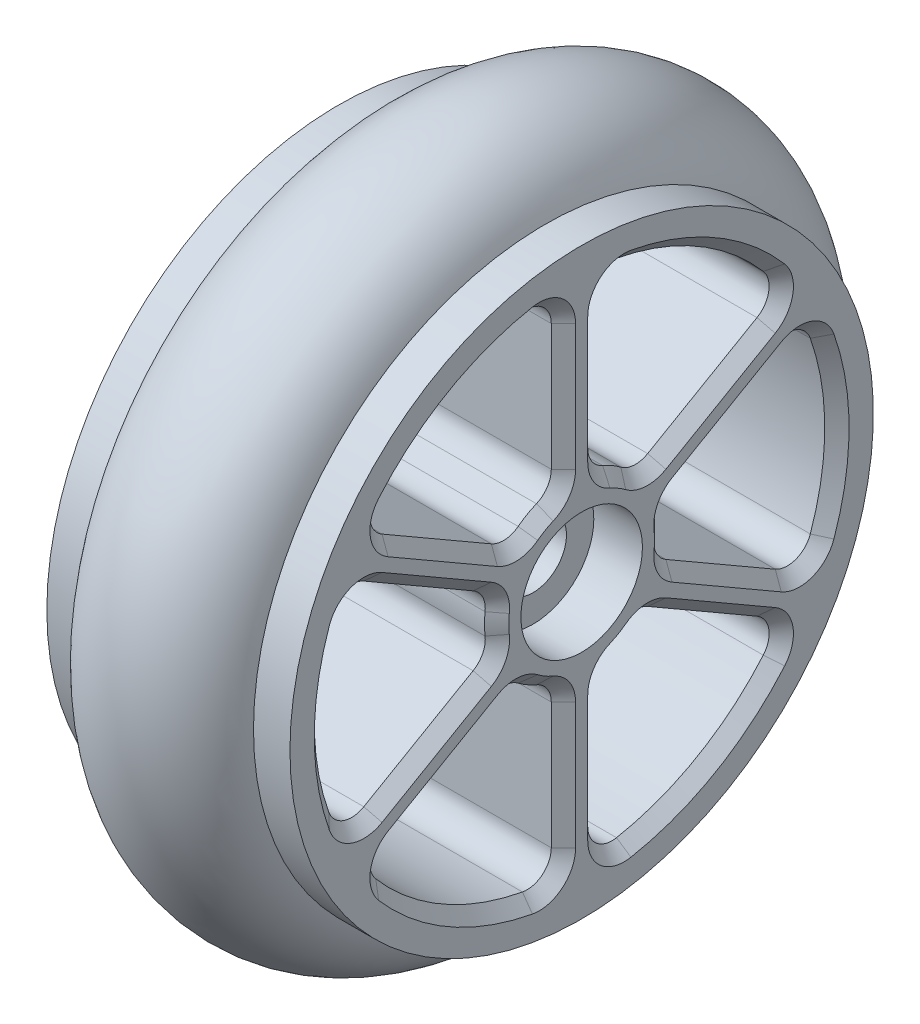
from build123d import *

# Parameters (mm, degrees)
CUT_EXTRUDE1_REACH = 47.629
SKETCH2_R          = 2.75
SKETCH3_R          = 5
CUT_EXTRUDE2_DEPTH = 4
CUT_EXTRUDE3_START = -4
SKETCH4_R          = 5
CUT_EXTRUDE3_DEPTH = 4
CUT_EXTRUDE4_REACH = 47.629
FILLET2_R          = 2
CHAMFER1_SIZE      = 1
CUT_EXTRUDE6_REACH = 55.638
SKETCH9_R          = 1.5


with BuildPart() as part:
    # Sketch1 → Revolve1 (revolve)
    with BuildSketch(Plane.XY):
        with BuildLine():
            Line((-10, 24), (-10, 0))
            Line((-10, 0), (10, 0))
            Line((10, 0), (10, 24))
            Line((10, 24), (7, 24))
            ThreePointArc((7, 24), (0, 29), (-7, 24))
            Line((-7, 24), (-10, 24))
        make_face()
    revolve(axis=Axis((-29.685693942, 0, 0), (1, 0, 0)))

    # Sketch2 → Cut-Extrude1 (cut, up to next)
    with BuildSketch(Plane(origin=(10, 0, 0), x_dir=(0, 0, -1), z_dir=(1, 0, 0)), mode=Mode.PRIVATE) as cut_extrude1_sk1:
        Circle(SKETCH2_R)
    cut_extrude1_tool1 = extrude(cut_extrude1_sk1.sketch, amount=-CUT_EXTRUDE1_REACH, mode=Mode.PRIVATE) & part.part
    add(cut_extrude1_tool1.solids().sort_by_distance((10, 0, 0))[0], mode=Mode.SUBTRACT)

    # Sketch3 → Cut-Extrude2 (cut)
    with BuildSketch(Plane.ZY.offset(10)):
        Circle(SKETCH3_R)
    extrude(amount=-CUT_EXTRUDE2_DEPTH, mode=Mode.SUBTRACT)

    # Sketch4 → Cut-Extrude3 (cut)
    with BuildSketch(Plane(origin=(10, 0, 0), x_dir=(0, 0, -1), z_dir=(1, 0, 0)).offset(CUT_EXTRUDE3_START)):
        Circle(SKETCH4_R)
    extrude(amount=CUT_EXTRUDE3_DEPTH, mode=Mode.SUBTRACT)

    # Sketch5 → Cut-Extrude4 (cut, up to next)
    with BuildSketch(Plane(origin=(10, 0, 0), x_dir=(0, 0, -1), z_dir=(1, 0, 0)), mode=Mode.PRIVATE) as cut_extrude4_sk1:
        with BuildLine():
            Line((1.5, -6.837397166), (1.5, -20.946360066))
            ThreePointArc((1.5, -20.946360066), (10.5, -18.186533479), (17.390079934, -11.772218139))
            Line((17.390079934, -11.772218139), (5.171359641, -4.717736688))
            ThreePointArc((5.171359641, -4.717736688), (3.5, -6.062177826), (1.5, -6.837397166))
        make_face()
    cut_extrude4_tool1 = extrude(cut_extrude4_sk1.sketch, amount=-CUT_EXTRUDE4_REACH, mode=Mode.PRIVATE) & part.part
    # Sketch5 → Cut-Extrude4 (cut, up to next)
    with BuildSketch(Plane(origin=(10, 0, 0), x_dir=(0, 0, -1), z_dir=(1, 0, 0)), mode=Mode.PRIVATE) as cut_extrude4_sk2:
        with BuildLine():
            Line((-1.5, -20.946360066), (-1.5, -6.837397166))
            ThreePointArc((-1.5, -6.837397166), (-3.5, -6.062177826), (-5.171359641, -4.717736688))
            Line((-5.171359641, -4.717736688), (-17.390079934, -11.772218139))
            ThreePointArc((-17.390079934, -11.772218139), (-10.5, -18.186533479), (-1.5, -20.946360066))
        make_face()
    cut_extrude4_tool2 = extrude(cut_extrude4_sk2.sketch, amount=-CUT_EXTRUDE4_REACH, mode=Mode.PRIVATE) & part.part
    # Sketch5 → Cut-Extrude4 (cut, up to next)
    with BuildSketch(Plane(origin=(10, 0, 0), x_dir=(0, 0, -1), z_dir=(1, 0, 0)), mode=Mode.PRIVATE) as cut_extrude4_sk3:
        with BuildLine():
            Line((6.671359641, -2.119660477), (18.890079934, -9.174141927))
            ThreePointArc((18.890079934, -9.174141927), (21, 0), (18.890079934, 9.174141927))
            Line((18.890079934, 9.174141927), (6.671359641, 2.119660477))
            ThreePointArc((6.671359641, 2.119660477), (7, 0), (6.671359641, -2.119660477))
        make_face()
    cut_extrude4_tool3 = extrude(cut_extrude4_sk3.sketch, amount=-CUT_EXTRUDE4_REACH, mode=Mode.PRIVATE) & part.part
    # Sketch5 → Cut-Extrude4 (cut, up to next)
    with BuildSketch(Plane(origin=(10, 0, 0), x_dir=(0, 0, -1), z_dir=(1, 0, 0)), mode=Mode.PRIVATE) as cut_extrude4_sk4:
        with BuildLine():
            Line((-18.890079934, -9.174141927), (-6.671359641, -2.119660477))
            ThreePointArc((-6.671359641, -2.119660477), (-7, 0), (-6.671359641, 2.119660477))
            Line((-6.671359641, 2.119660477), (-18.890079934, 9.174141927))
            ThreePointArc((-18.890079934, 9.174141927), (-21, 0), (-18.890079934, -9.174141927))
        make_face()
    cut_extrude4_tool4 = extrude(cut_extrude4_sk4.sketch, amount=-CUT_EXTRUDE4_REACH, mode=Mode.PRIVATE) & part.part
    # Sketch5 → Cut-Extrude4 (cut, up to next)
    with BuildSketch(Plane(origin=(10, 0, 0), x_dir=(0, 0, -1), z_dir=(1, 0, 0)), mode=Mode.PRIVATE) as cut_extrude4_sk5:
        with BuildLine():
            ThreePointArc((-5.171359641, 4.717736688), (-3.5, 6.062177826), (-1.5, 6.837397166))
            Line((-1.5, 6.837397166), (-1.5, 20.946360066))
            ThreePointArc((-1.5, 20.946360066), (-10.5, 18.186533479), (-17.390079934, 11.772218139))
            Line((-17.390079934, 11.772218139), (-5.171359641, 4.717736688))
        make_face()
    cut_extrude4_tool5 = extrude(cut_extrude4_sk5.sketch, amount=-CUT_EXTRUDE4_REACH, mode=Mode.PRIVATE) & part.part
    # Sketch5 → Cut-Extrude4 (cut, up to next)
    with BuildSketch(Plane(origin=(10, 0, 0), x_dir=(0, 0, -1), z_dir=(1, 0, 0)), mode=Mode.PRIVATE) as cut_extrude4_sk6:
        with BuildLine():
            Line((5.171359641, 4.717736688), (17.390079934, 11.772218139))
            ThreePointArc((17.390079934, 11.772218139), (10.5, 18.186533479), (1.5, 20.946360066))
            Line((1.5, 20.946360066), (1.5, 6.837397166))
            ThreePointArc((1.5, 6.837397166), (3.5, 6.062177826), (5.171359641, 4.717736688))
        make_face()
    cut_extrude4_tool6 = extrude(cut_extrude4_sk6.sketch, amount=-CUT_EXTRUDE4_REACH, mode=Mode.PRIVATE) & part.part
    add(cut_extrude4_tool1.solids().sort_by_distance((10, -12.993011, -7.501518))[0], mode=Mode.SUBTRACT)
    add(cut_extrude4_tool2.solids().sort_by_distance((10, -12.993011, 7.501518))[0], mode=Mode.SUBTRACT)
    add(cut_extrude4_tool3.solids().sort_by_distance((10, 0, -15.003037))[0], mode=Mode.SUBTRACT)
    add(cut_extrude4_tool4.solids().sort_by_distance((10, 0, 15.003037))[0], mode=Mode.SUBTRACT)
    add(cut_extrude4_tool5.solids().sort_by_distance((10, 12.993011, 7.501518))[0], mode=Mode.SUBTRACT)
    add(cut_extrude4_tool6.solids().sort_by_distance((10, 12.993011, -7.501518))[0], mode=Mode.SUBTRACT)

    # Fillet2
    fillet2_edges = [part.edges().sort_by_distance(p)[0] for p in [
        (0, 11.772218139, -17.390079934),
        (0, 4.717736688, -5.171359641),
        (0, 6.837397166, -1.5),
        (0, 20.946360066, -1.5),
        (0, 20.946360066, 1.5),
        (0, 11.772218139, 17.390079934),
        (0, 4.717736688, 5.171359641),
        (0, 6.837397166, 1.5),
        (0, 9.174141927, 18.890079934),
        (0, -9.174141927, 18.890079934),
        (0, -2.119660477, 6.671359641),
        (0, 2.119660477, 6.671359641),
        (0, -6.837397166, 1.5),
        (0, -4.717736688, 5.171359641),
        (0, -11.772218139, 17.390079934),
        (0, -20.946360066, 1.5),
        (0, -20.946360066, -1.5),
        (0, -11.772218139, -17.390079934),
        (0, -4.717736688, -5.171359641),
        (0, -6.837397166, -1.5),
        (0, -2.119660477, -6.671359641),
        (0, 2.119660477, -6.671359641),
        (0, 9.174141927, -18.890079934),
        (0, -9.174141927, -18.890079934),
    ]]
    fillet(fillet2_edges, radius=FILLET2_R)

    # Chamfer1
    chamfer1_edges = [part.edges().sort_by_distance(p)[0] for p in [
        (10, 6.062177826, 3.5),
        (10, 7.186020379, 1.833333333),
        (10, 5.18072343, 5.306609534),
        (10, 13.483205686, 1.5),
        (10, 8.040640949, 10.926798649),
        (10, 20.213816925, 2.222667253),
        (10, 12.031794768, 16.394345338),
        (10, 18.186533479, 10.5),
        (10, 0, 7),
        (10, 2.005296949, 7.139942867),
        (10, -2.005296949, 7.139942867),
        (10, 5.442564738, 12.426798649),
        (10, -5.442564738, 12.426798649),
        (10, 8.182022158, 18.617012591),
        (10, -8.182022158, 18.617012591),
        (10, 0, 21),
        (10, -6.062177826, 3.5),
        (10, -5.18072343, 5.306609534),
        (10, -7.186020379, 1.833333333),
        (10, -8.040640949, 10.926798649),
        (10, -13.483205686, 1.5),
        (10, -12.031794768, 16.394345338),
        (10, -20.213816925, 2.222667253),
        (10, -18.186533479, 10.5),
        (10, -6.062177826, -3.5),
        (10, -7.186020379, -1.833333333),
        (10, -5.18072343, -5.306609534),
        (10, -13.483205686, -1.5),
        (10, -8.040640949, -10.926798649),
        (10, -20.213816925, -2.222667253),
        (10, -12.031794768, -16.394345338),
        (10, -18.186533479, -10.5),
        (10, 0, -7),
        (10, -2.005296949, -7.139942867),
        (10, 2.005296949, -7.139942867),
        (10, -5.442564738, -12.426798649),
        (10, 5.442564738, -12.426798649),
        (10, -8.182022158, -18.617012591),
        (10, 8.182022158, -18.617012591),
        (10, 0, -21),
        (10, 6.062177826, -3.5),
        (10, 5.18072343, -5.306609534),
        (10, 7.186020379, -1.833333333),
        (10, 8.040640949, -10.926798649),
        (10, 13.483205686, -1.5),
        (10, 12.031794768, -16.394345338),
        (10, 20.213816925, -2.222667253),
        (10, 18.186533479, -10.5),
    ]]
    chamfer(chamfer1_edges, length=CHAMFER1_SIZE)

    # Sketch8 → Cut-Revolve1 (revolve, cut)
    with BuildSketch(Plane.XY):
        with BuildLine():
            ThreePointArc((6, 23.827105745), (0, 28), (-6, 23.827105745))
            Line((-6, 23.827105745), (-6, 22.827105745))
            Line((-6, 22.827105745), (6, 22.827105745))
            Line((6, 22.827105745), (6, 23.827105745))
        make_face()
    revolve(axis=Axis((-25.031120021, 0, 0), (1, 0, 0)), mode=Mode.SUBTRACT)

    # Sketch9 → Cut-Extrude6 (cut, up to next)
    with BuildSketch(Plane.XY.offset(15), mode=Mode.PRIVATE) as cut_extrude6_sk1:
        Circle(SKETCH9_R)
    cut_extrude6_tool1 = extrude(cut_extrude6_sk1.sketch, amount=CUT_EXTRUDE6_REACH, mode=Mode.PRIVATE) & part.part
    cut_extrude6 = cut_extrude6_tool1.solids().sort_by_distance((0, 0, 15))[0]
    add(cut_extrude6, mode=Mode.SUBTRACT)

    # Mirror1: Cut-Extrude6 across plane
    add(cut_extrude6.mirror(Plane.XY), mode=Mode.SUBTRACT)


solid = part.part
